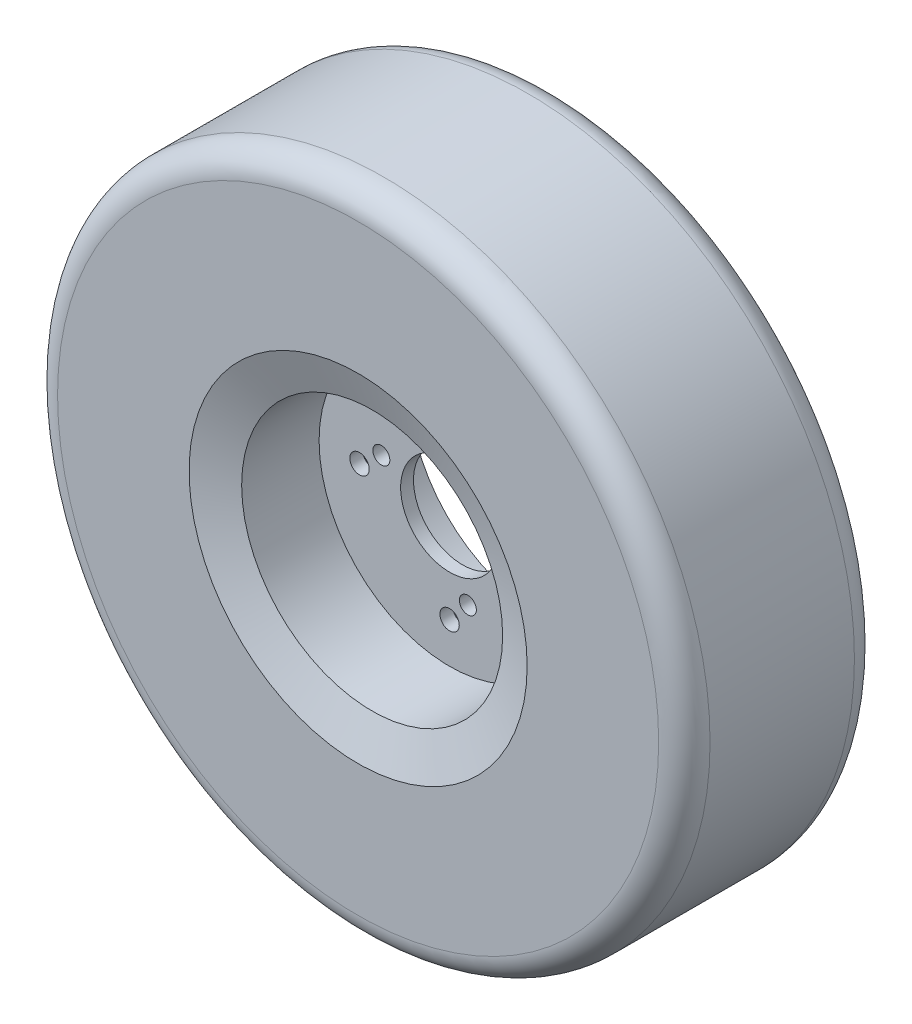
from build123d import *
from OCP.BRepFilletAPI import BRepFilletAPI_MakeChamfer

# Parameters (mm, degrees)
SKETCH1_R                            = 127
SKETCH1_R_2                          = 50.8
BOSS_EXTRUDE1_DEPTH                  = 38.1
CHAMFER1_SIZE                        = 15
CHAMFER1_SIZE2                       = 5.459553514
FILLET1_R                            = 10
SKETCH2_R                            = 50.8
SKETCH2_R_2                          = 19.05
BOSS_EXTRUDE2_DEPTH                  = 2.5
F_19_64_0_29688_DIAMETER_HOLE1_D     = 7.540752
F_19_64_0_29688_DIAMETER_HOLE1_DEPTH = 18.75
F_19_64_0_29688_DIAMETER_HOLE1_TIP   = 2.265470457
M6_CLEARANCE_HOLE1_D                 = 6.6
M6_CLEARANCE_HOLE1_DEPTH             = 18.75
M6_CLEARANCE_HOLE1_TIP               = 1.982840043


with BuildPart() as part:
    # Sketch1 → Boss-Extrude1 (new, symmetric)
    with BuildSketch(Plane.XY):
        Circle(SKETCH1_R)
        Circle(SKETCH1_R_2, mode=Mode.SUBTRACT)
    extrude(amount=BOSS_EXTRUDE1_DEPTH, both=True)

    # Chamfer1: one chamfer whose edges measure the first distance from different faces: ONE call of the kernel's chamfer builder (chamfer() names one face for all edges)
    chamfer1_edges_1 = [part.edges().sort_by_distance(p)[0] for p in [
        (-50.8, 0, 38.1),
    ]]
    chamfer1_side_1 = [part.faces().sort_by_distance(p)[0] for p in [
        (-123.407897552, 0, 38.1),
    ]]
    chamfer1_edges_2 = [part.edges().sort_by_distance(p)[0] for p in [
        (-50.8, 0, -38.1),
    ]]
    chamfer1_side_2 = [part.faces().sort_by_distance(p)[0] for p in [
        (-123.407897552, 0, -38.1),
    ]]
    chamfer1 = BRepFilletAPI_MakeChamfer(part.part.solid().wrapped)
    for e in chamfer1_edges_1:
        chamfer1.Add(CHAMFER1_SIZE, CHAMFER1_SIZE2, e.wrapped, chamfer1_side_1[0].wrapped)  # the first distance lies on this face
    for e in chamfer1_edges_2:
        chamfer1.Add(CHAMFER1_SIZE, CHAMFER1_SIZE2, e.wrapped, chamfer1_side_2[0].wrapped)  # the first distance lies on this face
    add(Compound.cast(chamfer1.Shape()), mode=Mode.REPLACE)

    # Fillet1
    fillet1_edges = [part.edges().sort_by_distance(p)[0] for p in [
        (-127, 0, -38.1),
        (-127, 0, 38.1),
    ]]
    fillet(fillet1_edges, radius=FILLET1_R)

    # Sketch2 → Boss-Extrude2 (add, symmetric)
    with BuildSketch(Plane.XY):
        Circle(SKETCH2_R)
        Circle(SKETCH2_R_2, mode=Mode.SUBTRACT)
    extrude(amount=BOSS_EXTRUDE2_DEPTH, both=True)

    # 19/64 (0.29688) Diameter Hole1
    with Locations(Plane.XY.offset(2.5)):
        with Locations((0, 35.052), (35.052, 0), (0, -35.052), (-35.052, 0)):
            Hole(F_19_64_0_29688_DIAMETER_HOLE1_D / 2, depth=F_19_64_0_29688_DIAMETER_HOLE1_DEPTH)
            with Locations((0, 0, -(F_19_64_0_29688_DIAMETER_HOLE1_DEPTH + F_19_64_0_29688_DIAMETER_HOLE1_TIP / 2))):  # 118° drill point
                Cone(0, F_19_64_0_29688_DIAMETER_HOLE1_D / 2, F_19_64_0_29688_DIAMETER_HOLE1_TIP, mode=Mode.SUBTRACT)

    # M6 Clearance Hole1
    with Locations(Plane.XY.offset(2.5)):
        with Locations((-26.562960223, 7.11752374), (19.445436483, 19.445436483), (7.11752374, -26.562960223)):
            Hole(M6_CLEARANCE_HOLE1_D / 2, depth=M6_CLEARANCE_HOLE1_DEPTH)
            with Locations((0, 0, -(M6_CLEARANCE_HOLE1_DEPTH + M6_CLEARANCE_HOLE1_TIP / 2))):  # 118° drill point
                Cone(0, M6_CLEARANCE_HOLE1_D / 2, M6_CLEARANCE_HOLE1_TIP, mode=Mode.SUBTRACT)


solid = part.part
